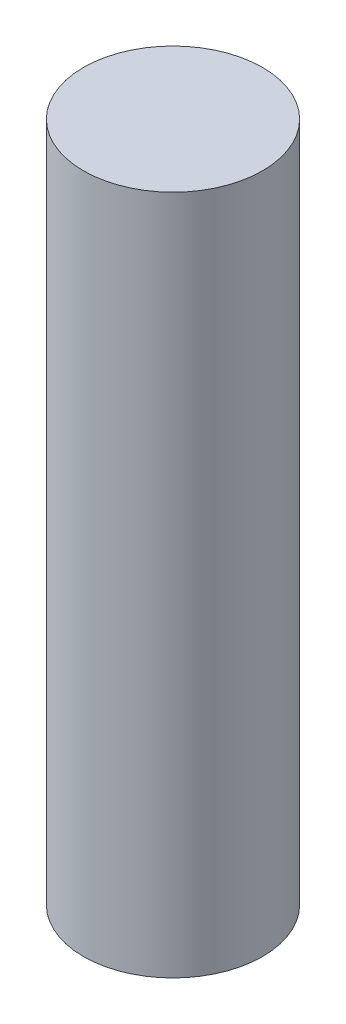
from build123d import *

# Parameters (mm, degrees)
BOSS_EXTRUDE1_DEPTH      = 19
BOSS_EXTRUDE1_DEPTH_BACK = 19
SKETCH1_R                = 5


with BuildPart() as part:
    # Sketch1 → Boss-Extrude1 (new, two sides: drawn at the far end of the back side and taken through both)
    with BuildSketch(Plane(origin=(0, 0, 0), x_dir=(1, 0, 0), z_dir=(0, 1, 0)).offset(-BOSS_EXTRUDE1_DEPTH_BACK)):
        Circle(SKETCH1_R)
    extrude(amount=BOSS_EXTRUDE1_DEPTH + BOSS_EXTRUDE1_DEPTH_BACK)


solid = part.part
